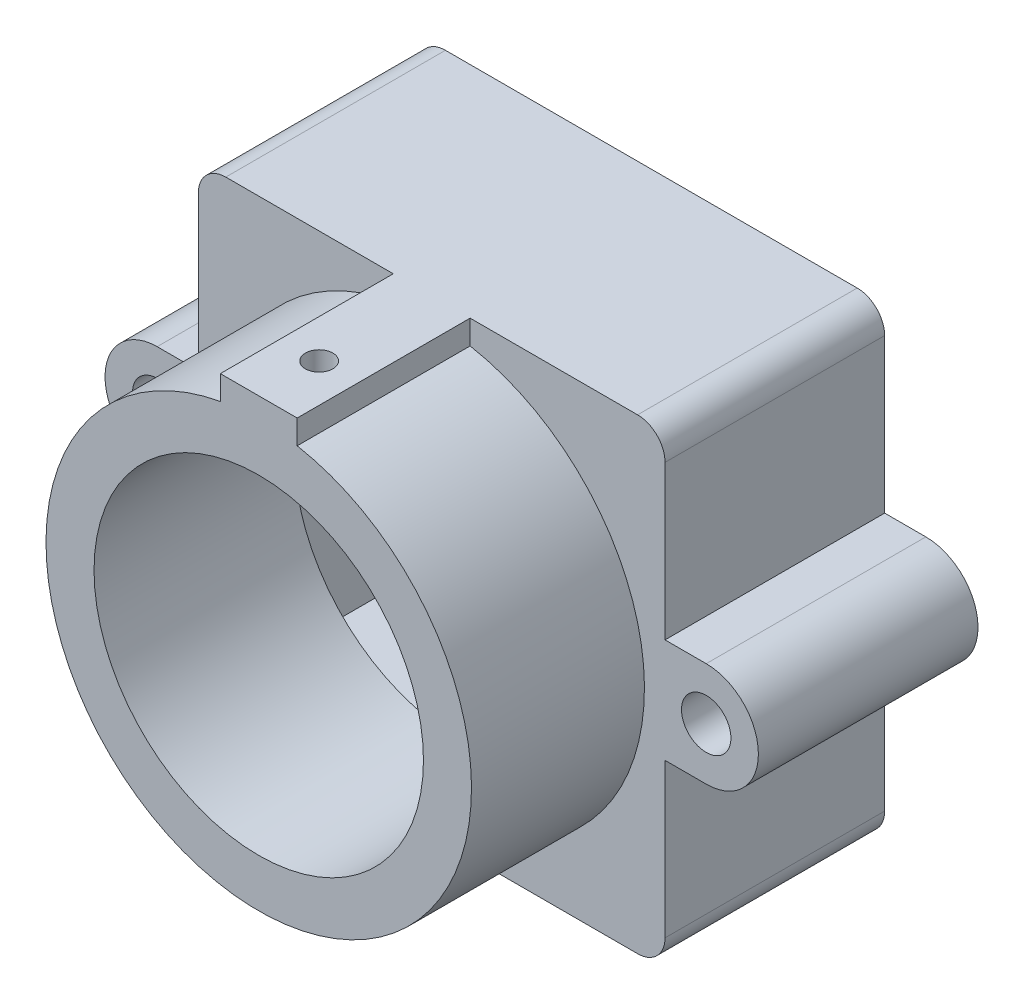
from build123d import *
from OCP.BRepAlgoAPI import BRepAlgoAPI_Cut
from OCP.TopTools import TopTools_ListOfShape

# Parameters (mm, degrees)
SKETCH1_R                 = 0.9
BOSS_EXTRUDE1_DEPTH       = 8
SKETCH2_R                 = 7.75
SKETCH2_R_2               = 6
BOSS_EXTRUDE2_DEPTH       = 6.3
BOSS_EXTRUDE3_REACH       = 22.454
SKETCH4_W                 = 2.8
SKETCH4_H                 = 0.87750041
CUT_EXTRUDE1_REACH        = 27.201
CUT_EXTRUDE1_END_RADIUS   = 6
SKETCH3_R                 = 0.05
SHELL1_DEPTH              = 7
SHELL1_START              = 7
SHELL1_2_DEPTH            = 4.129175608
SHELL1_START_2            = 13.07082292
SHELL1_3_DEPTH            = 0.22917708
SHELL1_START_3            = 6.988561285
SHELL1_4_DEPTH            = 0.511438715
SKETCH2_2_R               = 6
CUT_EXTRUDE2_DEPTH        = 17.669133202
F_1_0MM_DOWEL_HOLE1_D     = 1
F_1_0MM_DOWEL_HOLE1_DEPTH = 3
F_1_0MM_DOWEL_HOLE1_TIP   = 0.30043031


with BuildPart() as part:
    # Sketch1 → Boss-Extrude1 (new body)
    with BuildSketch(Plane.XY):
        with BuildLine():
            Line((-7.5, -8.5), (7.5, -8.5))
            ThreePointArc((7.5, -8.5), (8.207106781, -8.207106781), (8.5, -7.5))
            Line((8.5, -7.5), (8.5, -1.9))
            Line((8.5, -1.9), (10, -1.9))
            ThreePointArc((10, -1.9), (11.9, 0), (10, 1.9))
            Line((10, 1.9), (8.5, 1.9))
            Line((8.5, 1.9), (8.5, 7.5))
            ThreePointArc((8.5, 7.5), (8.207106781, 8.207106781), (7.5, 8.5))
            Line((7.5, 8.5), (-7.5, 8.5))
            ThreePointArc((-7.5, 8.5), (-8.207106781, 8.207106781), (-8.5, 7.5))
            Line((-8.5, 7.5), (-8.5, 1.9))
            Line((-8.5, 1.9), (-10, 1.9))
            ThreePointArc((-10, 1.9), (-11.9, 0), (-10, -1.9))
            Line((-10, -1.9), (-8.5, -1.9))
            Line((-8.5, -1.9), (-8.5, -7.5))
            ThreePointArc((-8.5, -7.5), (-8.207106781, -8.207106781), (-7.5, -8.5))
        make_face()
        with Locations((-10, 0)):
            Circle(SKETCH1_R, mode=Mode.SUBTRACT)
        with Locations(Location((10, 0, 0), (0, 0, 180))):
            Circle(SKETCH1_R, mode=Mode.SUBTRACT)
    extrude(amount=BOSS_EXTRUDE1_DEPTH)

    # Sketch2 → Boss-Extrude2 (add)
    with BuildSketch(Plane(origin=(0, 0, 8), x_dir=(-1, 0, 0), z_dir=(0, 0, -1))):
        Circle(SKETCH2_R)
        Circle(SKETCH2_R_2, mode=Mode.SUBTRACT)
    extrude(amount=-BOSS_EXTRUDE2_DEPTH)

    # Sketch4 → Boss-Extrude3 (add, up to next)
    with BuildSketch(Plane.XY.offset(14.3), mode=Mode.PRIVATE) as boss_extrude3_sk1:
        with Locations((0, 8.061249795)):
            Rectangle(SKETCH4_W, SKETCH4_H)
    boss_extrude3_tool1 = extrude(boss_extrude3_sk1.sketch, amount=-BOSS_EXTRUDE3_REACH, mode=Mode.PRIVATE) - part.part
    add(boss_extrude3_tool1.solids().sort_by_distance((0, 8.06125, 14.3))[0])

    # Cut-Extrude1: up to this cylinder (the profile starts outside it)
    cut_extrude1_end = Plane(origin=(0, 0, 12.1), z_dir=(0, 0, -1)) * Cylinder(CUT_EXTRUDE1_END_RADIUS, 67.402, mode=Mode.PRIVATE)
    # Sketch3 → Cut-Extrude1 (cut, up to the surface)
    with BuildSketch(Plane(origin=(0, 8.5, 0), x_dir=(-1, 0, 0), z_dir=(0, 1, 0)), mode=Mode.PRIVATE) as cut_extrude1_sk1:
        with Locations(Location((0, 12.1, 0), (0, 0, 90))):
            Circle(SKETCH3_R)
    cut_extrude1_tool1 = extrude(cut_extrude1_sk1.sketch, amount=-CUT_EXTRUDE1_REACH, mode=Mode.PRIVATE) - cut_extrude1_end
    add(cut_extrude1_tool1.solids().sort_by_distance((0, 8.5, 12.1))[0], mode=Mode.SUBTRACT)


with BuildPart() as shell1_tool:
    # Shell1: read off the stored shape, not the designer's step
    # Shell1 outline → Shell1 (new body)
    with BuildSketch(Plane.XY):
        with BuildLine():
            Line((7.5, -0.9), (8.326679947, -0.9))
            ThreePointArc((8.326679947, -0.9), (8.1, 0), (8.326679947, 0.9))
            Line((8.326679947, 0.9), (7.5, 0.9))
            Line((7.5, 0.9), (7.5, 7.5))
            Line((7.5, 7.5), (-7.5, 7.5))
            Line((-7.5, 7.5), (-7.5, 0.9))
            Line((-7.5, 0.9), (-8.326679947, 0.9))
            ThreePointArc((-8.326679947, 0.9), (-8.1, 0), (-8.326679947, -0.9))
            Line((-8.326679947, -0.9), (-7.5, -0.9))
            Line((-7.5, -0.9), (-7.5, -7.5))
            Line((-7.5, -7.5), (7.5, -7.5))
            Line((7.5, -7.5), (7.5, -0.9))
        make_face()
    extrude(amount=SHELL1_DEPTH)


with BuildPart() as part_1:
    add(part.part)

    # Shell1: cut by shell1_tool, with a tolerance
    shell1_stock = TopTools_ListOfShape()
    shell1_stock.Append(part_1.part.wrapped)
    shell1_tools = TopTools_ListOfShape()
    shell1_tools.Append(shell1_tool.part.wrapped)
    shell1_cut = BRepAlgoAPI_Cut()
    shell1_cut.SetArguments(shell1_stock)
    shell1_cut.SetTools(shell1_tools)
    shell1_cut.SetFuzzyValue(0.00001)
    shell1_cut.Build()
    add(Compound.cast(shell1_cut.Shape()).solids(), mode=Mode.REPLACE)


with BuildPart() as shell1_2_tool:
    # Shell1 2 outline → Shell1 2 (new body)
    with BuildSketch(Plane.XY.offset(SHELL1_START)):
        with BuildLine():
            Line((0.4, 6.988562084), (0.4, 7.5))
            Line((0.4, 7.5), (-0.4, 7.5))
            Line((-0.4, 7.5), (-0.4, 6.988562084))
            ThreePointArc((-0.4, 6.988562084), (0, 7), (0.4, 6.988562084))
        make_face()
    extrude(amount=SHELL1_2_DEPTH)


with BuildPart() as part_2:
    add(part_1.part)

    # Shell1 2: cut by shell1_2_tool, with a tolerance
    shell1_2_stock = TopTools_ListOfShape()
    shell1_2_stock.Append(part_2.part.wrapped)
    shell1_2_tools = TopTools_ListOfShape()
    shell1_2_tools.Append(shell1_2_tool.part.wrapped)
    shell1_2_cut = BRepAlgoAPI_Cut()
    shell1_2_cut.SetArguments(shell1_2_stock)
    shell1_2_cut.SetTools(shell1_2_tools)
    shell1_2_cut.SetFuzzyValue(0.00001)
    shell1_2_cut.Build()
    add(Compound.cast(shell1_2_cut.Shape()).solids(), mode=Mode.REPLACE)


with BuildPart() as shell1_3_tool:
    # Shell1 3 outline → Shell1 3 (new body)
    with BuildSketch(Plane.XY.offset(SHELL1_START_2)):
        with BuildLine():
            Line((0.4, 6.988562084), (0.4, 7.5))
            Line((0.4, 7.5), (-0.4, 7.5))
            Line((-0.4, 7.5), (-0.4, 6.988562084))
            ThreePointArc((-0.4, 6.988562084), (0, 7), (0.4, 6.988562084))
        make_face()
    extrude(amount=SHELL1_3_DEPTH)


with BuildPart() as part_3:
    add(part_2.part)

    # Shell1 3: cut by shell1_3_tool, with a tolerance
    shell1_3_stock = TopTools_ListOfShape()
    shell1_3_stock.Append(part_3.part.wrapped)
    shell1_3_tools = TopTools_ListOfShape()
    shell1_3_tools.Append(shell1_3_tool.part.wrapped)
    shell1_3_cut = BRepAlgoAPI_Cut()
    shell1_3_cut.SetArguments(shell1_3_stock)
    shell1_3_cut.SetTools(shell1_3_tools)
    shell1_3_cut.SetFuzzyValue(0.00001)
    shell1_3_cut.Build()
    add(Compound.cast(shell1_3_cut.Shape()).solids(), mode=Mode.REPLACE)


with BuildPart() as shell1_4_tool:
    # Shell1 4 outline → Shell1 4 (new body)
    with BuildSketch(Plane(origin=(0, 0, 0), x_dir=(1, 0, 0), z_dir=(0, 1, 0)).offset(SHELL1_START_3)):
        with BuildLine():
            Line((-0.4, -11.129175608), (0.4, -11.129175608))
            ThreePointArc((0.4, -11.129175608), (0, -11.05), (-0.4, -11.129175608))
        make_face()
        with BuildLine():
            Line((0.4, -13.070824392), (-0.4, -13.070824392))
            ThreePointArc((-0.4, -13.070824392), (0, -13.15), (0.4, -13.070824392))
        make_face()
    extrude(amount=SHELL1_4_DEPTH)


with BuildPart() as part_4:
    add(part_3.part)


with BuildPart() as part_5:
    # Shell1 4: joined with shell1_4_tool
    add(part_4.part.fuse(shell1_4_tool.part, tol=0.00001))

    # Sketch2<2> → Cut-Extrude2 (cut, through all)
    with BuildSketch(Plane(origin=(0, 0, 8), x_dir=(-1, 0, 0), z_dir=(0, 0, -1))):
        Circle(SKETCH2_2_R)
    extrude(amount=CUT_EXTRUDE2_DEPTH, mode=Mode.SUBTRACT)

    # Ø1.0mm Dowel Hole1
    with Locations(Plane(origin=(0, 8.5, 12.1), x_dir=(0, 0, 1), z_dir=(0, 1, 0))):
        with Locations((0, 0)):
            Hole(F_1_0MM_DOWEL_HOLE1_D / 2, depth=F_1_0MM_DOWEL_HOLE1_DEPTH)
            with Locations((0, 0, -(F_1_0MM_DOWEL_HOLE1_DEPTH + F_1_0MM_DOWEL_HOLE1_TIP / 2))):  # 118° drill point
                Cone(0, F_1_0MM_DOWEL_HOLE1_D / 2, F_1_0MM_DOWEL_HOLE1_TIP, mode=Mode.SUBTRACT)


solid = part_5.part
